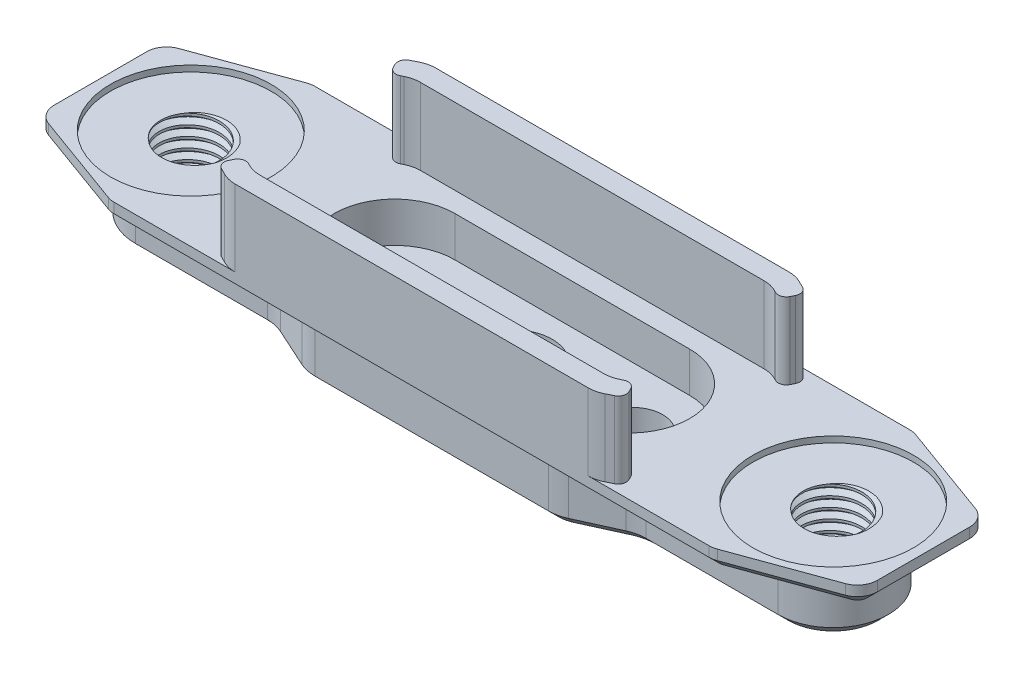
from build123d import *

# Parameters (mm, degrees)
BOSS_EXTRUDE1_DEPTH = 1
CHAMFER1_SIZE       = 0.5
SKETCH2_R           = 2
SKETCH2_R_2         = 1.5
BOSS_EXTRUDE2_DEPTH = 3
CHAMFER2_SIZE       = 0.5
SKETCH4_R           = 4
CUT_EXTRUDE2_DEPTH  = 0.3
CUT_EXTRUDE3_DEPTH  = 2
BOSS_EXTRUDE3_DEPTH = 3.8
SKETCH10_R          = 1.5
CUT_EXTRUDE4_DEPTH  = 22.495580941
THREAD4_PITCH       = 0.5
THREAD5_PITCH       = 0.5


with BuildPart() as part:
    # Sketch1 → Boss-Extrude1 (new body)
    with BuildSketch(Plane(origin=(0, 0, 0), x_dir=(1, 0, 0), z_dir=(0, 1, 0))):
        with BuildLine():
            Line((14.823825022, -5), (-14.823825022, -5))
            ThreePointArc((-14.823825022, -5), (-14.997328014, -4.984833342), (-15.165568085, -4.939793423))
            Line((-15.165568085, -4.939793423), (-19.841743063, -3.239366159))
            ThreePointArc((-19.841743063, -3.239366159), (-20.319067477, -2.873269928), (-20.5, -2.299572735))
            Line((-20.5, -2.299572735), (-20.5, 2.299572735))
            ThreePointArc((-20.5, 2.299572735), (-20.319067477, 2.873269928), (-19.841743063, 3.239366159))
            Line((-19.841743063, 3.239366159), (-15.165568085, 4.939793423))
            ThreePointArc((-15.165568085, 4.939793423), (-14.997328014, 4.984833342), (-14.823825022, 5))
            Line((-14.823825022, 5), (14.823825022, 5))
            ThreePointArc((14.823825022, 5), (14.997328014, 4.984833342), (15.165568085, 4.939793423))
            Line((15.165568085, 4.939793423), (19.841743063, 3.239366159))
            ThreePointArc((19.841743063, 3.239366159), (20.319067477, 2.873269928), (20.5, 2.299572735))
            Line((20.5, 2.299572735), (20.5, -2.299572735))
            ThreePointArc((20.5, -2.299572735), (20.319067477, -2.873269928), (19.841743063, -3.239366159))
            Line((19.841743063, -3.239366159), (15.165568085, -4.939793423))
            ThreePointArc((15.165568085, -4.939793423), (14.997328014, -4.984833342), (14.823825022, -5))
        make_face()
    extrude(amount=BOSS_EXTRUDE1_DEPTH)

    # Chamfer1
    chamfer1_edges = [part.edges().sort_by_distance(p)[0] for p in [
        (-17.503655574, 0, -4.089579791),
        (-14.997328014, 0, -4.984833342),
        (0, 0, -5),
        (14.997328014, 0, -4.984833342),
        (17.503655574, 0, -4.089579791),
        (20.319067477, 0, -2.873269928),
        (20.5, 0, 0),
        (20.319067477, 0, 2.873269928),
        (17.503655574, 0, 4.089579791),
        (14.997328014, 0, 4.984833342),
        (0, 0, 5),
        (-14.997328014, 0, 4.984833342),
        (-17.503655574, 0, 4.089579791),
        (-20.319067477, 0, 2.873269928),
        (-20.5, 0, 0),
        (-20.319067477, 0, -2.873269928),
    ]]
    chamfer(chamfer1_edges, length=CHAMFER1_SIZE)

    # Sketch2 → Boss-Extrude2 (add)
    with BuildSketch(Plane.XZ):
        with BuildLine():
            Line((-16, 2.75), (-9.433218389, 2.75))
            ThreePointArc((-9.433218389, 2.75), (-9.009818998, 2.795330474), (-8.605612501, 2.929267045))
            Line((-8.605612501, 2.929267045), (-6.644387499, 3.820732955))
            ThreePointArc((-6.644387499, 3.820732955), (-6.240181002, 3.954669526), (-5.816781611, 4))
            Line((-5.816781611, 4), (5.816781611, 4))
            ThreePointArc((5.816781611, 4), (6.240181002, 3.954669526), (6.644387499, 3.820732955))
            Line((6.644387499, 3.820732955), (8.605612501, 2.929267045))
            ThreePointArc((8.605612501, 2.929267045), (9.009818998, 2.795330474), (9.433218389, 2.75))
            Line((9.433218389, 2.75), (16, 2.75))
            ThreePointArc((16, 2.75), (18.75, 0), (16, -2.75))
            Line((16, -2.75), (9.433218389, -2.75))
            ThreePointArc((9.433218389, -2.75), (9.009818998, -2.795330474), (8.605612501, -2.929267045))
            Line((8.605612501, -2.929267045), (6.644387499, -3.820732955))
            ThreePointArc((6.644387499, -3.820732955), (6.240181002, -3.954669526), (5.816781611, -4))
            Line((5.816781611, -4), (-5.816781611, -4))
            ThreePointArc((-5.816781611, -4), (-6.240181002, -3.954669526), (-6.644387499, -3.820732955))
            Line((-6.644387499, -3.820732955), (-8.605612501, -2.929267045))
            ThreePointArc((-8.605612501, -2.929267045), (-9.009818998, -2.795330474), (-9.433218389, -2.75))
            Line((-9.433218389, -2.75), (-16, -2.75))
            ThreePointArc((-16, -2.75), (-18.75, 0), (-16, 2.75))
        make_face()
        with Locations(Location((0, 0, 0), (0, 0, 270))):
            Circle(SKETCH2_R, mode=Mode.SUBTRACT)
        with Locations(Location((-6, 0, 0), (0, 0, 270))):
            Circle(SKETCH2_R_2, mode=Mode.SUBTRACT)
        with Locations(Location((6, 0, 0), (0, 0, 270))):
            Circle(SKETCH2_R_2, mode=Mode.SUBTRACT)
    extrude(amount=BOSS_EXTRUDE2_DEPTH)

    # Chamfer2
    chamfer2_edges = [part.edges().sort_by_distance(p)[0] for p in [
        (9.009818998, -3, 2.795330474),
        (7.625, -3, 3.375),
        (6.240181002, -3, 3.954669526),
        (0, -3, 4),
        (-6.240181002, -3, 3.954669526),
        (-7.625, -3, 3.375),
        (-9.009818998, -3, 2.795330474),
        (-12.716609195, -3, 2.75),
        (-18.75, -3, 0),
        (-12.716609195, -3, -2.75),
        (-9.009818998, -3, -2.795330474),
        (-7.625, -3, -3.375),
        (-6.240181002, -3, -3.954669526),
        (0, -3, -4),
        (6.240181002, -3, -3.954669526),
        (7.625, -3, -3.375),
        (9.009818998, -3, -2.795330474),
        (12.716609195, -3, -2.75),
        (18.75, -3, 0),
        (12.716609195, -3, 2.75),
    ]]
    chamfer(chamfer2_edges, length=CHAMFER2_SIZE)

    # Sketch4 → Cut-Extrude2 (cut)
    with BuildSketch(Plane(origin=(0, 1, 0), x_dir=(1, 0, 0), z_dir=(0, 1, 0))):
        with Locations(Location((-16, 0, 0), (0, 0, 270))):
            Circle(SKETCH4_R)
        with Locations(Location((16, 0, 0), (0, 0, 270))):
            Circle(SKETCH4_R)
    extrude(amount=-CUT_EXTRUDE2_DEPTH, mode=Mode.SUBTRACT)

    # Sketch5 → Cut-Extrude3 (cut)
    with BuildSketch(Plane(origin=(0, 1, 0), x_dir=(1, 0, 0), z_dir=(0, 1, 0))):
        with BuildLine():
            Line((5.85, -3), (-5.85, -3))
            ThreePointArc((-5.85, -3), (-8.85, 0), (-5.85, 3))
            Line((-5.85, 3), (5.85, 3))
            ThreePointArc((5.85, 3), (8.85, 0), (5.85, -3))
        make_face()
    extrude(amount=-CUT_EXTRUDE3_DEPTH, mode=Mode.SUBTRACT)

    # Sketch6 → Boss-Extrude3 (add)
    with BuildSketch(Plane(origin=(0, 1, 0), x_dir=(1, 0, 0), z_dir=(0, 1, 0))):
        with BuildLine():
            Line((-8.795898034, 5), (8.795898034, 5))
            ThreePointArc((8.795898034, 5), (9.140527415, 4.959873484), (9.466718427, 4.841640786))
            Line((9.466718427, 4.841640786), (9.792229124, 4.678885438))
            ThreePointArc((9.792229124, 4.678885438), (9.992817005, 4.447605668), (9.971114562, 4.142229124))
            Line((9.971114562, 4.142229124), (9.881671843, 3.963343685))
            ThreePointArc((9.881671843, 3.963343685), (9.650392073, 3.762755804), (9.345015528, 3.784458247))
            Line((9.345015528, 3.784458247), (9.23065045, 3.841640786))
            ThreePointArc((9.23065045, 3.841640786), (8.904459437, 3.959873484), (8.559830056, 4))
            Line((8.559830056, 4), (-8.559830056, 4))
            ThreePointArc((-8.559830056, 4), (-8.904459437, 3.959873484), (-9.23065045, 3.841640786))
            Line((-9.23065045, 3.841640786), (-9.345015528, 3.784458247))
            ThreePointArc((-9.345015528, 3.784458247), (-9.650392073, 3.762755804), (-9.881671843, 3.963343685))
            Line((-9.881671843, 3.963343685), (-9.971114562, 4.142229124))
            ThreePointArc((-9.971114562, 4.142229124), (-9.992817005, 4.447605668), (-9.792229124, 4.678885438))
            Line((-9.792229124, 4.678885438), (-9.466718427, 4.841640786))
            ThreePointArc((-9.466718427, 4.841640786), (-9.140527415, 4.959873484), (-8.795898034, 5))
        make_face()
        with BuildLine():
            Line((9.971114562, -4.142229124), (9.881671843, -3.963343685))
            ThreePointArc((9.881671843, -3.963343685), (9.650392073, -3.762755804), (9.345015528, -3.784458247))
            Line((9.345015528, -3.784458247), (9.23065045, -3.841640786))
            ThreePointArc((9.23065045, -3.841640786), (8.904459437, -3.959873484), (8.559830056, -4))
            Line((8.559830056, -4), (-8.559830056, -4))
            ThreePointArc((-8.559830056, -4), (-8.904459437, -3.959873484), (-9.23065045, -3.841640786))
            Line((-9.23065045, -3.841640786), (-9.345015528, -3.784458247))
            ThreePointArc((-9.345015528, -3.784458247), (-9.650392073, -3.762755804), (-9.881671843, -3.963343685))
            Line((-9.881671843, -3.963343685), (-9.971114562, -4.142229124))
            ThreePointArc((-9.971114562, -4.142229124), (-9.992817005, -4.447605668), (-9.792229124, -4.678885438))
            Line((-9.792229124, -4.678885438), (-9.466718427, -4.841640786))
            ThreePointArc((-9.466718427, -4.841640786), (-9.140527415, -4.959873484), (-8.795898034, -5))
            Line((-8.795898034, -5), (8.795898034, -5))
            ThreePointArc((8.795898034, -5), (9.140527415, -4.959873484), (9.466718427, -4.841640786))
            Line((9.466718427, -4.841640786), (9.792229124, -4.678885438))
            ThreePointArc((9.792229124, -4.678885438), (9.992817005, -4.447605668), (9.971114562, -4.142229124))
        make_face()
    extrude(amount=BOSS_EXTRUDE3_DEPTH)

    # Sketch10 → Cut-Extrude4 (cut, through all)
    with BuildSketch(Plane(origin=(0, 0.7, 0), x_dir=(1, 0, 0), z_dir=(0, 1, 0))):
        with Locations(Location((-16, 0, 0), (0, 0, 270))):
            Circle(SKETCH10_R)
        with Locations(Location((16, 0, 0), (0, 0, 270))):
            Circle(SKETCH10_R)
    extrude(amount=-CUT_EXTRUDE4_DEPTH, mode=Mode.SUBTRACT)

    # Thread4: the profile of Thread Profile5 profile screwed along a right-hand helix of 7.4 turns, 6 arcs to a turn; built about Z, then put on its axis
    thread4_z = Axis((0, 0, 0), (0, 0, 1))
    thread4_corners = [(1.4997, 0, -0.000173205), (1.770632938, 0, 0.156249999), (1.770632938, 0, 0.218749999), (1.4997, 0, 0.375173204)]
    with BuildLine(mode=Mode.PRIVATE) as thread4_profile:
        Line(thread4_corners[0], thread4_corners[1])
        Line(thread4_corners[1], thread4_corners[2])
        Line(thread4_corners[2], thread4_corners[3])
        Line(thread4_corners[3], thread4_corners[0])
    thread4_cap = Face(thread4_profile.wire())
    thread4_turn_angles = [0, 30, 60, 90, 120, 150, 180, 210, 240, 270, 300, 330, 360]
    thread4_turn_weights = [1, 0.8660254037844387, 1, 0.8660254037844387, 1, 0.8660254037844387, 1, 0.8660254037844387, 1, 0.8660254037844387, 1, 0.8660254037844387, 1]
    thread4_turn_rails = [Edge.make_bspline([Vector(p[0], p[1], 0).rotate(thread4_z, thread4_turn_angles[k]) / thread4_turn_weights[k] + Vector(0, 0, p[2] + THREAD4_PITCH * thread4_turn_angles[k] / 360) for k in range(13)], [0, 0, 0, 1, 1, 2, 2, 3, 3, 4, 4, 5, 5, 6, 6, 6], 2, thread4_turn_weights) for p in thread4_corners]
    thread4_turn_sides = [Face.make_surface_from_curves(thread4_turn_rails[p[0]], thread4_turn_rails[p[1]]) for p in [(0, 1), (1, 2), (2, 3), (3, 0)]]
    thread4_last_angles = [2520, 2550, 2580, 2610, 2640, 2652, 2664]
    thread4_last_weights = [1, 0.8660254037844387, 1, 0.8660254037844387, 1, 0.9781476007338057, 1]
    thread4_last_rails = [Edge.make_bspline([Vector(p[0], p[1], 0).rotate(thread4_z, thread4_last_angles[k]) / thread4_last_weights[k] + Vector(0, 0, p[2] + THREAD4_PITCH * thread4_last_angles[k] / 360) for k in range(7)], [0, 0, 0, 1, 1, 2, 2, 3, 3, 3], 2, thread4_last_weights) for p in thread4_corners]
    thread4_last_sides = [Face.make_surface_from_curves(thread4_last_rails[p[0]], thread4_last_rails[p[1]]) for p in [(0, 1), (1, 2), (2, 3), (3, 0)]]
    thread4 = Plane(origin=(-16, -3, 0), x_dir=(1, 0, 0), z_dir=(0, 1, 0)) * Solid(Shell([*[p.moved(Location((0, 0, THREAD4_PITCH * i))) for i in range(7) for p in thread4_turn_sides], *thread4_last_sides, thread4_cap, thread4_cap.rotate(thread4_z, 2664).moved(Location((0, 0, THREAD4_PITCH * 2664 / 360)))]))
    add(thread4, mode=Mode.SUBTRACT)

    # Thread5: the profile of Thread Profile6 profile screwed along a right-hand helix of 7.4 turns, 6 arcs to a turn; built about Z, then put on its axis
    thread5_z = Axis((0, 0, 0), (0, 0, 1))
    thread5_corners = [(1.4997, 0, -0.000173205), (1.770632938, 0, 0.156249999), (1.770632938, 0, 0.218749999), (1.4997, 0, 0.375173204)]
    with BuildLine(mode=Mode.PRIVATE) as thread5_profile:
        Line(thread5_corners[0], thread5_corners[1])
        Line(thread5_corners[1], thread5_corners[2])
        Line(thread5_corners[2], thread5_corners[3])
        Line(thread5_corners[3], thread5_corners[0])
    thread5_cap = Face(thread5_profile.wire())
    thread5_turn_angles = [0, 30, 60, 90, 120, 150, 180, 210, 240, 270, 300, 330, 360]
    thread5_turn_weights = [1, 0.8660254037844387, 1, 0.8660254037844387, 1, 0.8660254037844387, 1, 0.8660254037844387, 1, 0.8660254037844387, 1, 0.8660254037844387, 1]
    thread5_turn_rails = [Edge.make_bspline([Vector(p[0], p[1], 0).rotate(thread5_z, thread5_turn_angles[k]) / thread5_turn_weights[k] + Vector(0, 0, p[2] + THREAD5_PITCH * thread5_turn_angles[k] / 360) for k in range(13)], [0, 0, 0, 1, 1, 2, 2, 3, 3, 4, 4, 5, 5, 6, 6, 6], 2, thread5_turn_weights) for p in thread5_corners]
    thread5_turn_sides = [Face.make_surface_from_curves(thread5_turn_rails[p[0]], thread5_turn_rails[p[1]]) for p in [(0, 1), (1, 2), (2, 3), (3, 0)]]
    thread5_last_angles = [2520, 2550, 2580, 2610, 2640, 2652, 2664]
    thread5_last_weights = [1, 0.8660254037844387, 1, 0.8660254037844387, 1, 0.9781476007338057, 1]
    thread5_last_rails = [Edge.make_bspline([Vector(p[0], p[1], 0).rotate(thread5_z, thread5_last_angles[k]) / thread5_last_weights[k] + Vector(0, 0, p[2] + THREAD5_PITCH * thread5_last_angles[k] / 360) for k in range(7)], [0, 0, 0, 1, 1, 2, 2, 3, 3, 3], 2, thread5_last_weights) for p in thread5_corners]
    thread5_last_sides = [Face.make_surface_from_curves(thread5_last_rails[p[0]], thread5_last_rails[p[1]]) for p in [(0, 1), (1, 2), (2, 3), (3, 0)]]
    thread5 = Plane(origin=(16, -3, 0), x_dir=(1, 0, 0), z_dir=(0, 1, 0)) * Solid(Shell([*[p.moved(Location((0, 0, THREAD5_PITCH * i))) for i in range(7) for p in thread5_turn_sides], *thread5_last_sides, thread5_cap, thread5_cap.rotate(thread5_z, 2664).moved(Location((0, 0, THREAD5_PITCH * 2664 / 360)))]))
    add(thread5, mode=Mode.SUBTRACT)


solid = part.part
